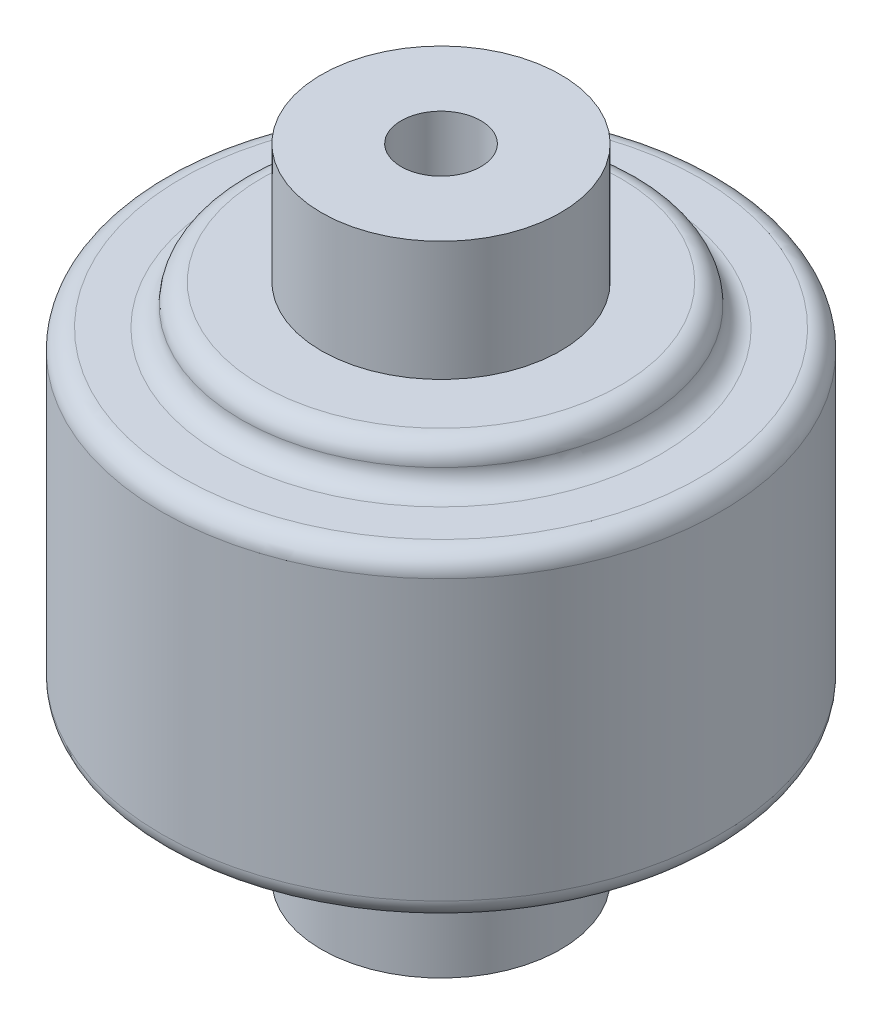
from build123d import *

# Parameters (mm, degrees)
FILLET1_R          = 0.25
SKETCH3_R          = 0.5
CUT_EXTRUDE1_DEPTH = 2.5


with BuildPart() as part:
    # Sketch2 → Revolve1 (revolve)
    with BuildSketch(Plane.XY, mode=Mode.PRIVATE) as revolve1_sk:
        Polygon((3.5, -2), (3.5, 2), (2.5, 2), (2.5, 2.5), (1.5, 2.5), (1.5, 4), (0, 4), (0, -4), (1.5, -4), (1.5, -2.5), (2.5, -2.5), (2.5, -2), align=None)
    revolve(revolve1_sk.sketch.rotate(Axis((0, 4, 0), (0, -1, 0)), 90), axis=Axis((0, 4, 0), (0, -1, 0)))

    # Fillet1
    fillet1_edges = [part.edges().sort_by_distance(p)[0] for p in [
        (0, -2, -2.5),
        (0, -2, -3.5),
        (0, 2, -3.5),
        (0, 2, -2.5),
        (0, 2.5, -2.5),
        (0, -2.5, -2.5),
    ]]
    fillet(fillet1_edges, radius=FILLET1_R - 0.0001)  # a hair under: the kernel refuses the full size

    # Sketch3 → Cut-Extrude1 (cut)
    with BuildSketch(Plane(origin=(0, 4, 0), x_dir=(1, 0, 0), z_dir=(0, 1, 0))):
        with Locations(Location((0, 0, 0), (0, 0, 270))):
            Circle(SKETCH3_R)
    cut_extrude1 = extrude(amount=-CUT_EXTRUDE1_DEPTH, mode=Mode.SUBTRACT)

    # Mirror1: Cut-Extrude1 across plane
    add(cut_extrude1.mirror(Plane.ZX), mode=Mode.SUBTRACT)


solid = part.part
